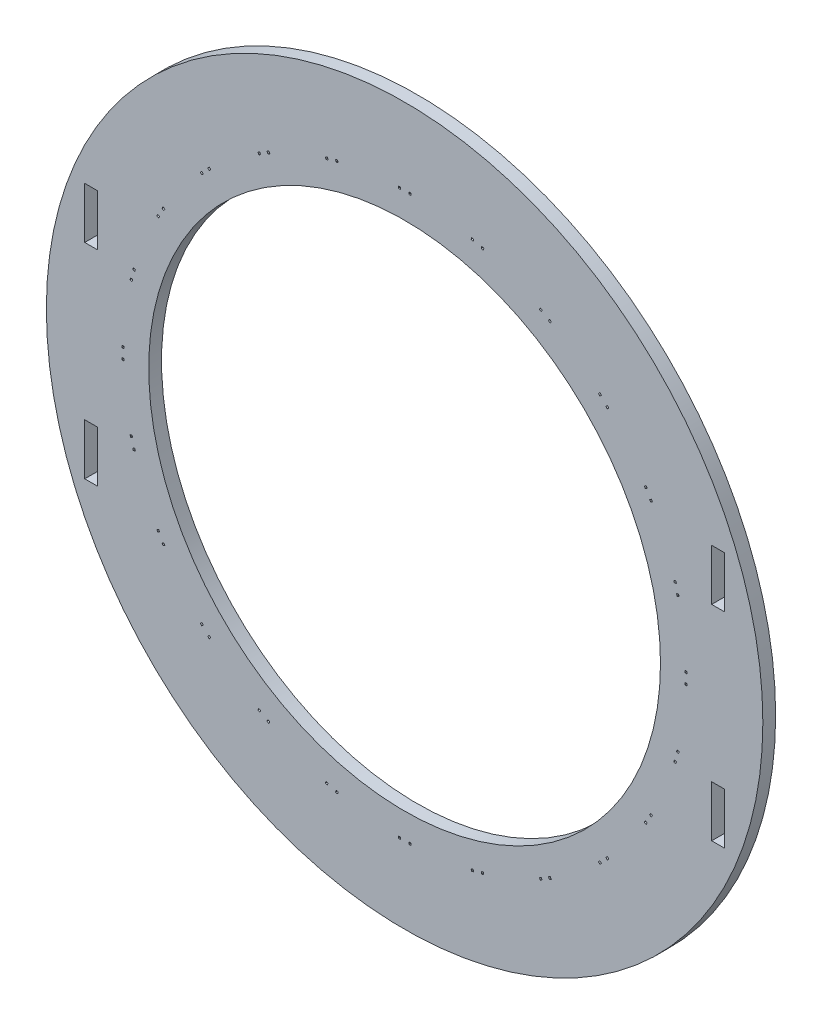
from build123d import *

# Parameters (mm, degrees)
SKETCH1_R           = 88.9
SKETCH1_R_2         = 63.5
SKETCH1_W           = 0.5334
SKETCH1_H           = 0.5334
SKETCH1_W_2         = 3.175
SKETCH1_H_2         = 12.7
BOSS_EXTRUDE1_DEPTH = 3.175


with BuildPart() as part:
    # Sketch1 → Boss-Extrude1 (new body)
    with BuildSketch(Plane.XY):
        Circle(SKETCH1_R)
        Circle(SKETCH1_R_2, mode=Mode.SUBTRACT)
        with Locations((-1.30175, 69.85)):
            Rectangle(SKETCH1_W, SKETCH1_H, mode=Mode.SUBTRACT)
        with Locations((1.30175, 69.85)):
            Rectangle(SKETCH1_W, SKETCH1_H, mode=Mode.SUBTRACT)
        Polygon((16.632530977, 68.133476115), (17.147755813, 67.995422037), (17.009701735, 67.480197201), (16.494476899, 67.61825128), align=None, mode=Mode.SUBTRACT)
        Polygon((19.147318866, 67.459640732), (19.009264788, 66.944415896), (19.524489623, 66.806361817), (19.662543702, 67.321586653), align=None, mode=Mode.SUBTRACT)
        Polygon((33.700032455, 61.50706843), (34.161970406, 61.24036843), (33.895270406, 60.778430479), (33.433332455, 61.045130479), align=None, mode=Mode.SUBTRACT)
        Polygon((35.954729594, 60.20531843), (35.688029594, 59.743380479), (36.149967545, 59.476680479), (36.416667545, 59.93861843), align=None, mode=Mode.SUBTRACT)
        Polygon((48.470932413, 50.689055675), (48.848103171, 50.311884918), (48.470932413, 49.934714161), (48.093761656, 50.311884918), align=None, mode=Mode.SUBTRACT)
        Polygon((50.311884918, 48.848103171), (49.934714161, 48.470932413), (50.311884918, 48.093761656), (50.689055675, 48.470932413), align=None, mode=Mode.SUBTRACT)
        Polygon((59.93861843, 36.416667545), (60.20531843, 35.954729594), (59.743380479, 35.688029594), (59.476680479, 36.149967545), align=None, mode=Mode.SUBTRACT)
        Polygon((61.24036843, 34.161970406), (60.778430479, 33.895270406), (61.045130479, 33.433332455), (61.50706843, 33.700032455), align=None, mode=Mode.SUBTRACT)
        Polygon((67.321586653, 19.662543702), (67.459640732, 19.147318866), (66.944415896, 19.009264788), (66.806361817, 19.524489623), align=None, mode=Mode.SUBTRACT)
        Polygon((67.995422037, 17.147755813), (67.480197201, 17.009701735), (67.61825128, 16.494476899), (68.133476115, 16.632530977), align=None, mode=Mode.SUBTRACT)
        with Locations((69.85, 1.30175)):
            Rectangle(SKETCH1_W, SKETCH1_H, mode=Mode.SUBTRACT)
        with Locations((69.85, -1.30175)):
            Rectangle(SKETCH1_W, SKETCH1_H, mode=Mode.SUBTRACT)
        Polygon((68.133476115, -16.632530977), (67.995422037, -17.147755813), (67.480197201, -17.009701735), (67.61825128, -16.494476899), align=None, mode=Mode.SUBTRACT)
        Polygon((67.459640732, -19.147318866), (66.944415896, -19.009264788), (66.806361817, -19.524489623), (67.321586653, -19.662543702), align=None, mode=Mode.SUBTRACT)
        Polygon((61.50706843, -33.700032455), (61.24036843, -34.161970406), (60.778430479, -33.895270406), (61.045130479, -33.433332455), align=None, mode=Mode.SUBTRACT)
        Polygon((60.20531843, -35.954729594), (59.743380479, -35.688029594), (59.476680479, -36.149967545), (59.93861843, -36.416667545), align=None, mode=Mode.SUBTRACT)
        Polygon((50.689055675, -48.470932413), (50.311884918, -48.848103171), (49.934714161, -48.470932413), (50.311884918, -48.093761656), align=None, mode=Mode.SUBTRACT)
        Polygon((48.848103171, -50.311884918), (48.470932413, -49.934714161), (48.093761656, -50.311884918), (48.470932413, -50.689055675), align=None, mode=Mode.SUBTRACT)
        Polygon((36.416667545, -59.93861843), (35.954729594, -60.20531843), (35.688029594, -59.743380479), (36.149967545, -59.476680479), align=None, mode=Mode.SUBTRACT)
        Polygon((34.161970406, -61.24036843), (33.895270406, -60.778430479), (33.433332455, -61.045130479), (33.700032455, -61.50706843), align=None, mode=Mode.SUBTRACT)
        Polygon((19.662543702, -67.321586653), (19.147318866, -67.459640732), (19.009264788, -66.944415896), (19.524489623, -66.806361817), align=None, mode=Mode.SUBTRACT)
        Polygon((17.147755813, -67.995422037), (17.009701735, -67.480197201), (16.494476899, -67.61825128), (16.632530977, -68.133476115), align=None, mode=Mode.SUBTRACT)
        with Locations((1.30175, -69.85)):
            Rectangle(SKETCH1_W, SKETCH1_H, mode=Mode.SUBTRACT)
        with Locations((-1.30175, -69.85)):
            Rectangle(SKETCH1_W, SKETCH1_H, mode=Mode.SUBTRACT)
        Polygon((-16.632530977, -68.133476115), (-17.147755813, -67.995422037), (-17.009701735, -67.480197201), (-16.494476899, -67.61825128), align=None, mode=Mode.SUBTRACT)
        Polygon((-19.147318866, -67.459640732), (-19.009264788, -66.944415896), (-19.524489623, -66.806361817), (-19.662543702, -67.321586653), align=None, mode=Mode.SUBTRACT)
        Polygon((-33.700032455, -61.50706843), (-34.161970406, -61.24036843), (-33.895270406, -60.778430479), (-33.433332455, -61.045130479), align=None, mode=Mode.SUBTRACT)
        Polygon((-35.954729594, -60.20531843), (-35.688029594, -59.743380479), (-36.149967545, -59.476680479), (-36.416667545, -59.93861843), align=None, mode=Mode.SUBTRACT)
        Polygon((-48.470932413, -50.689055675), (-48.848103171, -50.311884918), (-48.470932413, -49.934714161), (-48.093761656, -50.311884918), align=None, mode=Mode.SUBTRACT)
        Polygon((-50.311884918, -48.848103171), (-49.934714161, -48.470932413), (-50.311884918, -48.093761656), (-50.689055675, -48.470932413), align=None, mode=Mode.SUBTRACT)
        Polygon((-59.93861843, -36.416667545), (-60.20531843, -35.954729594), (-59.743380479, -35.688029594), (-59.476680479, -36.149967545), align=None, mode=Mode.SUBTRACT)
        Polygon((-61.24036843, -34.161970406), (-60.778430479, -33.895270406), (-61.045130479, -33.433332455), (-61.50706843, -33.700032455), align=None, mode=Mode.SUBTRACT)
        Polygon((-67.321586653, -19.662543702), (-67.459640732, -19.147318866), (-66.944415896, -19.009264788), (-66.806361817, -19.524489623), align=None, mode=Mode.SUBTRACT)
        Polygon((-67.995422037, -17.147755813), (-67.480197201, -17.009701735), (-67.61825128, -16.494476899), (-68.133476115, -16.632530977), align=None, mode=Mode.SUBTRACT)
        with Locations((-69.85, -1.30175)):
            Rectangle(SKETCH1_W, SKETCH1_H, mode=Mode.SUBTRACT)
        with Locations((-69.85, 1.30175)):
            Rectangle(SKETCH1_W, SKETCH1_H, mode=Mode.SUBTRACT)
        Polygon((-68.133476115, 16.632530977), (-67.995422037, 17.147755813), (-67.480197201, 17.009701735), (-67.61825128, 16.494476899), align=None, mode=Mode.SUBTRACT)
        Polygon((-67.459640732, 19.147318866), (-66.944415896, 19.009264788), (-66.806361817, 19.524489623), (-67.321586653, 19.662543702), align=None, mode=Mode.SUBTRACT)
        Polygon((-61.50706843, 33.700032455), (-61.24036843, 34.161970406), (-60.778430479, 33.895270406), (-61.045130479, 33.433332455), align=None, mode=Mode.SUBTRACT)
        Polygon((-60.20531843, 35.954729594), (-59.743380479, 35.688029594), (-59.476680479, 36.149967545), (-59.93861843, 36.416667545), align=None, mode=Mode.SUBTRACT)
        Polygon((-50.689055675, 48.470932413), (-50.311884918, 48.848103171), (-49.934714161, 48.470932413), (-50.311884918, 48.093761656), align=None, mode=Mode.SUBTRACT)
        Polygon((-48.848103171, 50.311884918), (-48.470932413, 49.934714161), (-48.093761656, 50.311884918), (-48.470932413, 50.689055675), align=None, mode=Mode.SUBTRACT)
        Polygon((-36.416667545, 59.93861843), (-35.954729594, 60.20531843), (-35.688029594, 59.743380479), (-36.149967545, 59.476680479), align=None, mode=Mode.SUBTRACT)
        Polygon((-34.161970406, 61.24036843), (-33.895270406, 60.778430479), (-33.433332455, 61.045130479), (-33.700032455, 61.50706843), align=None, mode=Mode.SUBTRACT)
        Polygon((-19.662543702, 67.321586653), (-19.147318866, 67.459640732), (-19.009264788, 66.944415896), (-19.524489623, 66.806361817), align=None, mode=Mode.SUBTRACT)
        Polygon((-17.147755813, 67.995422037), (-17.009701735, 67.480197201), (-16.494476899, 67.61825128), (-16.632530977, 68.133476115), align=None, mode=Mode.SUBTRACT)
        with Locations((77.7875, 25.38476)):
            Rectangle(SKETCH1_W_2, SKETCH1_H_2, mode=Mode.SUBTRACT)
        with Locations((77.7875, -25.41524)):
            Rectangle(SKETCH1_W_2, SKETCH1_H_2, mode=Mode.SUBTRACT)
        with Locations((-77.7875, -25.41524)):
            Rectangle(SKETCH1_W_2, SKETCH1_H_2, mode=Mode.SUBTRACT)
        with Locations((-77.7875, 25.38476)):
            Rectangle(SKETCH1_W_2, SKETCH1_H_2, mode=Mode.SUBTRACT)
    extrude(amount=BOSS_EXTRUDE1_DEPTH)


solid = part.part
